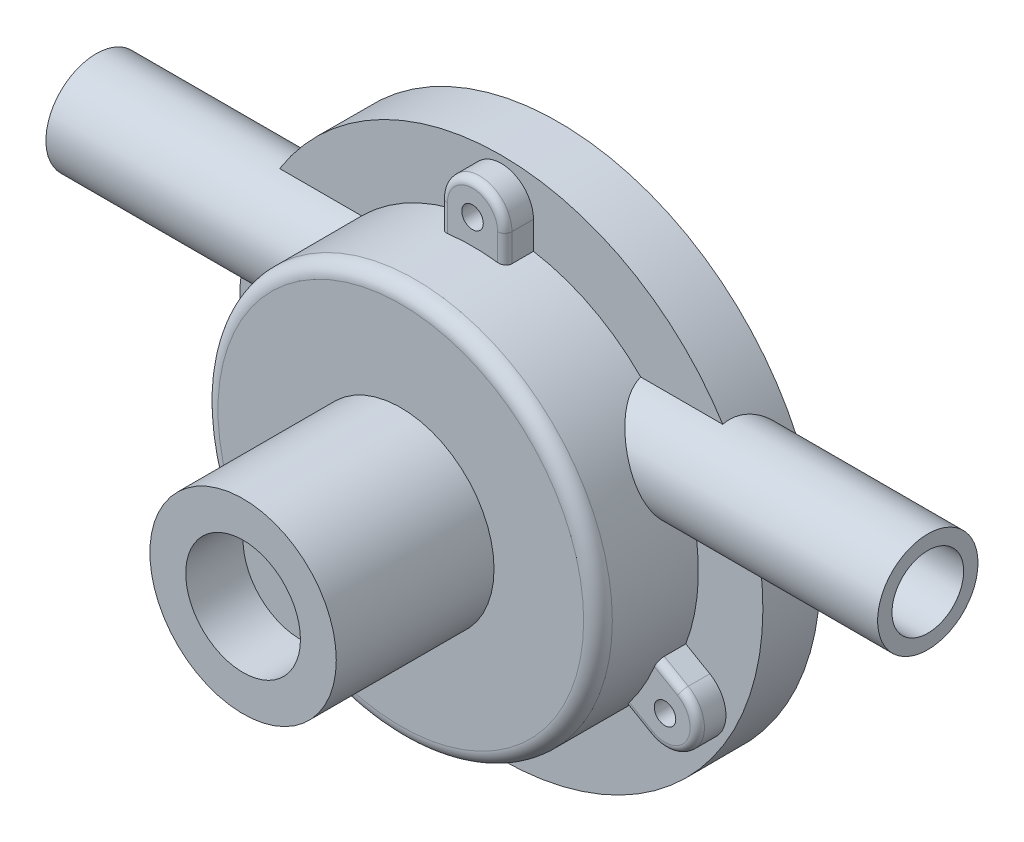
from build123d import *

# Parameters (mm, degrees)
SKETCH1_R                = 36.5
BOSS_EXTRUDE1_DEPTH      = 8
SKETCH2_R                = 27.5
BOSS_EXTRUDE2_DEPTH      = 14
SKETCH3_R                = 13
BOSS_EXTRUDE3_DEPTH      = 22
SKETCH4_R                = 8
CUT_EXTRUDE1_DEPTH       = 8
BOSS_EXTRUDE4_DEPTH      = 22
BOSS_EXTRUDE4_DEPTH_BACK = 94
SKETCH6_R                = 7
CUT_EXTRUDE2_DEPTH       = 12
SKETCH11_R               = 1.5
CUT_EXTRUDE4_DEPTH       = 82.795476764
FILLET1_R                = 2
SKETCH10_R               = 5
CUT_EXTRUDE5_DEPTH       = 130.322271982
SKETCH12_R               = 3.2
CUT_EXTRUDE6_DEPTH       = 78.784960154
SKETCH13_R               = 27.3
SKETCH13_R_2             = 25
CUT_EXTRUDE7_DEPTH       = 1.2
BOSS_EXTRUDE5_DEPTH      = 4
FILLET2_R                = 1
SKETCH15_R               = 1.5
CUT_EXTRUDE8_DEPTH       = 82.795476764


with BuildPart() as part:
    # Sketch1 → Boss-Extrude1 (new body)
    with BuildSketch(Plane.XY):
        Circle(SKETCH1_R)
    extrude(amount=BOSS_EXTRUDE1_DEPTH)

    # Sketch2 → Boss-Extrude2 (add)
    with BuildSketch(Plane.XY.offset(8)):
        Circle(SKETCH2_R)
    extrude(amount=BOSS_EXTRUDE2_DEPTH)

    # Sketch3 → Boss-Extrude3 (add)
    with BuildSketch(Plane.XY.offset(22)):
        Circle(SKETCH3_R)
    extrude(amount=BOSS_EXTRUDE3_DEPTH)

    # Sketch4 → Cut-Extrude1 (cut)
    with BuildSketch(Plane.XY.offset(44)):
        Circle(SKETCH4_R)
    extrude(amount=-CUT_EXTRUDE1_DEPTH, mode=Mode.SUBTRACT)

    # Sketch6 → Boss-Extrude4 (add, two sides: drawn at the far end of the back side and taken through both)
    with BuildSketch(Plane(origin=(36.5, 0, 0), x_dir=(0, 0, -1), z_dir=(1, 0, 0)).offset(-BOSS_EXTRUDE4_DEPTH_BACK)):
        with Locations((-7, 12.5)):
            Circle(SKETCH6_R)
    extrude(amount=BOSS_EXTRUDE4_DEPTH + BOSS_EXTRUDE4_DEPTH_BACK)

    # Sketch8 → Cut-Extrude2 (cut)
    with BuildSketch(Plane(origin=(0, 0, 0), x_dir=(-1, 0, 0), z_dir=(0, 0, -1))):
        with BuildLine():
            ThreePointArc((-17.653540721, 13.95), (0, -22.5), (17.653540721, 13.95))
            ThreePointArc((17.653540721, 13.95), (0, 18), (-17.653540721, 13.95))
        make_face()
    extrude(amount=-CUT_EXTRUDE2_DEPTH, mode=Mode.SUBTRACT)

    # Sketch11 → Cut-Extrude4 (cut, through all)
    with BuildSketch(Plane(origin=(0, 0, 0), x_dir=(-1, 0, 0), z_dir=(0, 0, -1))):
        with Locations((0, 31)):
            Circle(SKETCH11_R)
        with Locations((26.846787517, -15.5)):
            Circle(SKETCH11_R)
        with Locations((-26.846787517, -15.5)):
            Circle(SKETCH11_R)
    extrude(amount=-CUT_EXTRUDE4_DEPTH, mode=Mode.SUBTRACT)

    # Fillet1
    fillet1_edges = [part.edges().sort_by_distance(p)[0] for p in [
        (-27.5, 0, 22),
    ]]
    fillet(fillet1_edges, radius=FILLET1_R)

    # Sketch10 → Cut-Extrude5 (cut, through all)
    with BuildSketch(Plane(origin=(58.5, 0, 0), x_dir=(0, 0, -1), z_dir=(1, 0, 0))):
        with Locations((-7, 12.5)):
            Circle(SKETCH10_R)
    extrude(amount=-CUT_EXTRUDE5_DEPTH, mode=Mode.SUBTRACT)

    # Sketch12 → Cut-Extrude6 (cut, through all)
    with BuildSketch(Plane.XY.offset(36)):
        Circle(SKETCH12_R)
    extrude(amount=-CUT_EXTRUDE6_DEPTH, mode=Mode.SUBTRACT)

    # Sketch13 → Cut-Extrude7 (cut)
    with BuildSketch(Plane(origin=(0, 0, 0), x_dir=(-1, 0, 0), z_dir=(0, 0, -1))):
        Circle(SKETCH13_R)
        Circle(SKETCH13_R_2, mode=Mode.SUBTRACT)
    extrude(amount=-CUT_EXTRUDE7_DEPTH, mode=Mode.SUBTRACT)

    # Sketch14 → Boss-Extrude5 (add)
    with BuildSketch(Plane.XY.offset(8)):
        with BuildLine():
            Line((4.5, 31), (4.5, 27.129319933))
            ThreePointArc((4.5, 27.129319933), (0, 27.5), (-4.5, 27.129319933))
            Line((-4.5, 27.129319933), (-4.5, 31))
            ThreePointArc((-4.5, 31), (0, 35.5), (4.5, 31))
        make_face()
        with BuildLine():
            Line((29.096787517, -11.602885683), (25.744680249, -9.667545649))
            ThreePointArc((25.744680249, -9.667545649), (23.815698604, -13.75), (21.244680249, -17.461774283))
            Line((21.244680249, -17.461774283), (24.596787517, -19.397114317))
            ThreePointArc((24.596787517, -19.397114317), (30.743901834, -17.75), (29.096787517, -11.602885683))
        make_face()
        with BuildLine():
            Line((-24.596787517, -19.397114317), (-21.244680249, -17.461774283))
            ThreePointArc((-21.244680249, -17.461774283), (-23.815698604, -13.75), (-25.744680249, -9.667545649))
            Line((-25.744680249, -9.667545649), (-29.096787517, -11.602885683))
            ThreePointArc((-29.096787517, -11.602885683), (-30.743901834, -17.75), (-24.596787517, -19.397114317))
        make_face()
    extrude(amount=BOSS_EXTRUDE5_DEPTH)

    # Fillet2
    fillet2_edges = [part.edges().sort_by_distance(p)[0] for p in [
        (4.5, 29.064659966, 12),
        (-4.5, 29.064659966, 12),
        (22.920733883, -18.4294443, 12),
        (27.420733883, -10.635215666, 12),
        (-27.420733883, -10.635215666, 12),
        (-22.920733883, -18.4294443, 12),
        (0, 35.5, 12),
        (30.743901834, -17.75, 12),
        (-30.743901834, -17.75, 12),
    ]]
    fillet(fillet2_edges, radius=FILLET2_R)

    # Sketch15 → Cut-Extrude8 (cut, through all)
    with BuildSketch(Plane(origin=(0, 0, 0), x_dir=(-1, 0, 0), z_dir=(0, 0, -1))):
        with Locations((0, 31)):
            Circle(SKETCH15_R)
        with Locations((26.846787517, -15.5)):
            Circle(SKETCH15_R)
        with Locations((-26.846787517, -15.5)):
            Circle(SKETCH15_R)
    extrude(amount=-CUT_EXTRUDE8_DEPTH, mode=Mode.SUBTRACT)


solid = part.part
